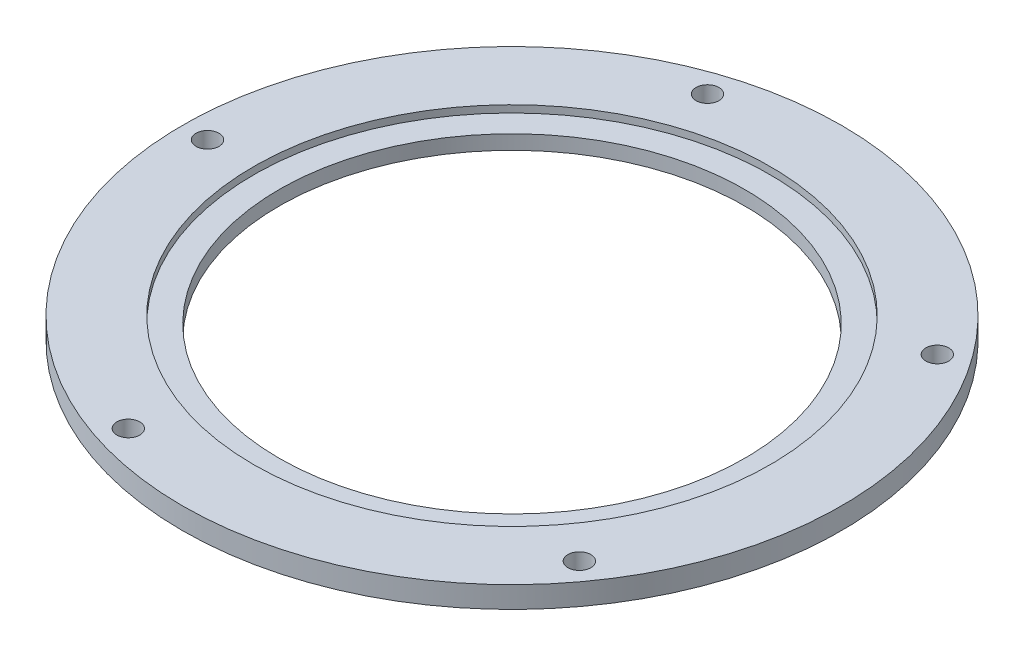
from build123d import *

# Parameters (mm, degrees)
SKETCH1_R            = 46
SKETCH1_R_2          = 36.05
BOSS_EXTRUDE1_DEPTH  = 3
SKETCH1_3_R          = 36.05
SKETCH1_3_R_2        = 32.5
BOSS_EXTRUDE2_DEPTH  = 2
M3_CLEARANCE_HOLE1_D = 3.2
CIRPATTERN1_COUNT    = 5


with BuildPart() as part:
    # Sketch1 → Boss-Extrude1 (new body)
    with BuildSketch(Plane(origin=(0, 0, 0), x_dir=(1, 0, 0), z_dir=(0, 1, 0))):
        Circle(SKETCH1_R)
        Circle(SKETCH1_R_2, mode=Mode.SUBTRACT)
    extrude(amount=BOSS_EXTRUDE1_DEPTH)

    # Sketch1<3> → Boss-Extrude2 (add)
    with BuildSketch(Plane(origin=(0, 0, 0), x_dir=(1, 0, 0), z_dir=(0, 1, 0))):
        Circle(SKETCH1_3_R)
        Circle(SKETCH1_3_R_2, mode=Mode.SUBTRACT)
    extrude(amount=BOSS_EXTRUDE2_DEPTH)

    # M3 Clearance Hole1 (through all)
    with Locations(Plane(origin=(0, 3, 0), x_dir=(1, 0, 0), z_dir=(0, 1, 0))):
        with Locations((-42.5, 0)):
            m3_clearance_hole1 = Hole(M3_CLEARANCE_HOLE1_D / 2)

    # CirPattern1: M3 Clearance Hole1 ×5 about axis
    cirpattern1_axis = Axis((0, 3, 0), (0, -1, 0))
    for i in range(1, CIRPATTERN1_COUNT):
        add(m3_clearance_hole1.rotate(cirpattern1_axis, i * 360 / CIRPATTERN1_COUNT), mode=Mode.SUBTRACT)


solid = part.part
